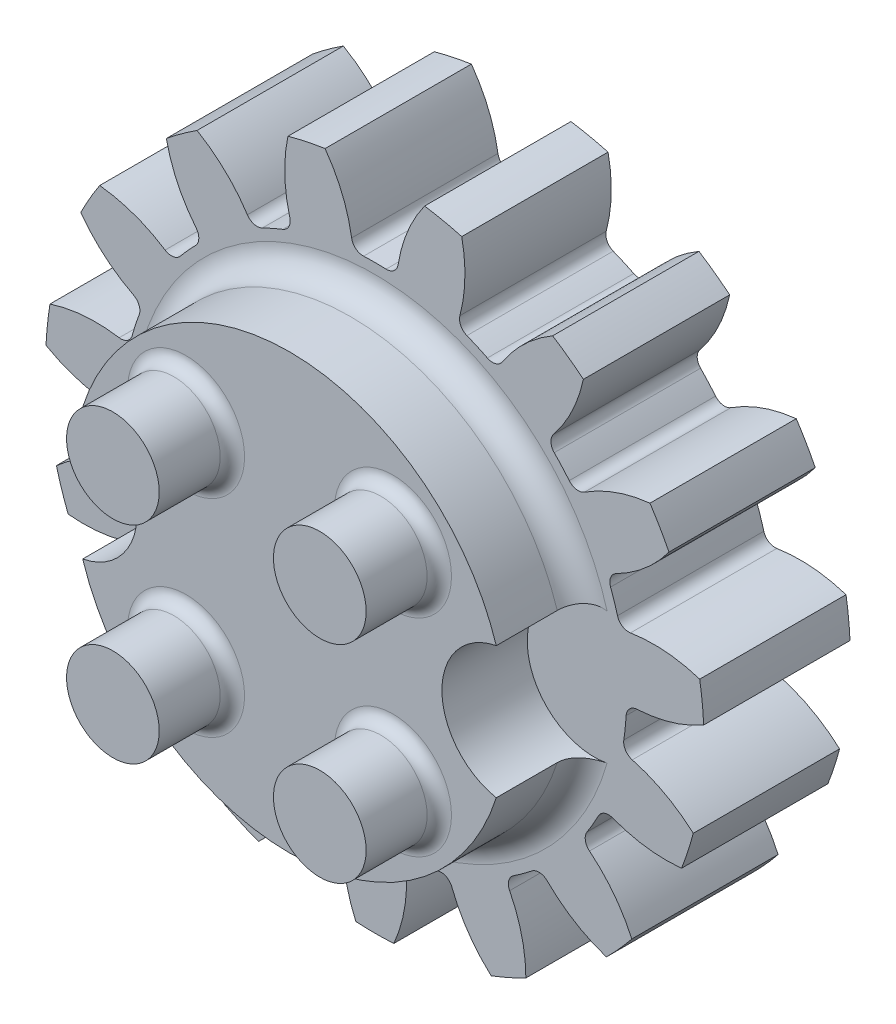
from build123d import *

# Parameters (mm, degrees)
SKETCH1_R                      = 13.5
BOSS_EXTRUDE1_DEPTH            = 3
CUT_EXTRUDE1_DEPTH             = 20.32614809
FILLET2_R                      = 0.476470588
CIRPATTERN1_COUNT              = 15
FILLET2_OF_CIRPATTERN1_R       = 0.476470588
THROUGH_CENTER_HOLE_DEPTH      = 20.315736881
THROUGH_CENTER_HOLE_DEPTH_BACK = 20.315736881
SKETCH5_R                      = 1.25
BOSS_EXTRUDE2_DEPTH            = 3.5
SKETCH7_R                      = 1.9
BOSS_EXTRUDE3_DEPTH            = 3
FILLET3_R                      = 1
FILLET4_R                      = 0.5


with BuildPart() as part:
    # Sketch1 → Boss-Extrude1 (new, symmetric)
    with BuildSketch(Plane.XY):
        Circle(SKETCH1_R)
    extrude(amount=BOSS_EXTRUDE1_DEPTH, both=True)

    # Sketch3 → Cut-Extrude1 (cut, symmetric)
    with BuildSketch(Plane.XY):
        with BuildLine():
            ThreePointArc((-2.040384037, 13.344917871), (-1.26191316, 11.892090906), (-0.898861073, 10.284323424))
            ThreePointArc((-0.898861073, 10.284323424), (0, 10.323529412), (0.898861073, 10.284323424))
            ThreePointArc((0.898861073, 10.284323424), (1.26191316, 11.892090906), (2.040384037, 13.344917871))
            ThreePointArc((2.040384037, 13.344917871), (0, 13.5), (-2.040384037, 13.344917871))
        make_face()
    cut_extrude1 = extrude(amount=CUT_EXTRUDE1_DEPTH, both=True, mode=Mode.SUBTRACT)

    # Fillet2
    fillet2_edges = [part.edges().sort_by_distance(p)[0] for p in [
        (0.898861073, 10.284323424, 0),
        (-0.898861073, 10.284323424, 0),
    ]]
    fillet(fillet2_edges, radius=FILLET2_R)

    # CirPattern1: Cut-Extrude1 ×15 about axis
    cirpattern1_axis = Axis((0, 0, 0), (0, 0, 1))
    for i in range(1, CIRPATTERN1_COUNT):
        add(cut_extrude1.rotate(cirpattern1_axis, i * 360 / CIRPATTERN1_COUNT), mode=Mode.SUBTRACT)

    # Fillet2 of CirPattern1
    fillet2_of_cirpattern1_edges = [part.edges().sort_by_distance(p)[0] for p in [
        (-3.361860735, 9.760796684, 0),
        (-5.004161636, 9.029597213, 0),
        (-7.041286281, 7.549539524, 0),
        (-8.244197191, 6.213571613, 0),
        (-9.503209461, 4.032898395, 0),
        (-10.058736155, 2.323163032, 0),
        (-10.321941391, -0.181067505, 0),
        (-10.134028257, -1.968941542, 0),
        (-9.355915883, -4.363725188, 0),
        (-8.457054809, -5.920598236, 0),
        (-6.772167522, -7.791855143, 0),
        (-5.317779754, -8.848529708, 0),
        (-3.017449874, -9.872702557, 0),
        (-1.25901227, -10.246470008, 0),
        (1.25901227, -10.246470008, 0),
        (3.017449874, -9.872702557, 0),
        (5.317779754, -8.848529708, 0),
        (6.772167522, -7.791855143, 0),
        (8.457054809, -5.920598236, 0),
        (9.355915883, -4.363725188, 0),
        (10.134028257, -1.968941542, 0),
        (10.321941391, -0.181067505, 0),
        (10.058736155, 2.323163032, 0),
        (9.503209461, 4.032898395, 0),
        (8.244197191, 6.213571613, 0),
        (7.041286281, 7.549539524, 0),
        (5.004161636, 9.029597213, 0),
        (3.361860735, 9.760796684, 0),
    ]]
    fillet(fillet2_of_cirpattern1_edges, radius=FILLET2_OF_CIRPATTERN1_R)

    # Sketch5 → Through_Center_Hole (cut, two sides: drawn at the far end of the back side and taken through both)
    with BuildSketch(Plane.XY.offset(-THROUGH_CENTER_HOLE_DEPTH_BACK)):
        Circle(SKETCH5_R)
    extrude(amount=THROUGH_CENTER_HOLE_DEPTH + THROUGH_CENTER_HOLE_DEPTH_BACK, mode=Mode.SUBTRACT)

    # Sketch6 → Boss-Extrude2 (add)
    with BuildSketch(Plane.XY.offset(3)):
        with BuildLine():
            ThreePointArc((-8.480416667, -2.700469063), (-6.25, 0), (-8.480416667, 2.700469063))
            ThreePointArc((-8.480416667, 2.700469063), (0, 8.9), (8.480416667, 2.700469063))
            ThreePointArc((8.480416667, 2.700469063), (6.25, 0), (8.480416667, -2.700469063))
            ThreePointArc((8.480416667, -2.700469063), (0, -8.9), (-8.480416667, -2.700469063))
        make_face()
    extrude(amount=BOSS_EXTRUDE2_DEPTH)

    # Sketch7 → Boss-Extrude3 (add)
    with BuildSketch(Plane.XY.offset(6.5)):
        with Locations((-4.242640687, 4.242640687)):
            Circle(SKETCH7_R)
        with Locations((4.242640687, 4.242640687)):
            Circle(SKETCH7_R)
        with Locations((4.242640687, -4.242640687)):
            Circle(SKETCH7_R)
        with Locations((-4.242640687, -4.242640687)):
            Circle(SKETCH7_R)
    extrude(amount=BOSS_EXTRUDE3_DEPTH)

    # Fillet3
    # the kernel refuses this fillet: 1 mm, written as the material it adds along each edge
    with BuildSketch(Plane(origin=(0, 0, 3), x_dir=(0.9996330098529925, -0.02708958494047193, 0), z_dir=(0.02708958494047193, 0.9996330098529925, 0))) as fillet3_piece_1_section:
        with BuildLine():
            CenterArc((8.9 + FILLET3_R, -FILLET3_R), FILLET3_R, 90, 90)
            Line((8.9, -FILLET3_R), (8.9, 0))
            Line((8.9, 0), (8.9 + FILLET3_R, 0))
        make_face()
    fillet3_piece_1 = revolve(axis=Axis((0, 0, 3), (0, 0, -1)), revolution_arc=176.895382431, mode=Mode.PRIVATE)
    fillet3_piece_1 = fillet3_piece_1 - Plane(origin=(9, 0, 3.280116287), x_dir=(-0.18893939393939513, 0.9819887501482969, 0), z_dir=(0, 0, -1)) * Cylinder(2.75, 40, mode=Mode.PRIVATE)
    fillet3_piece_1 = fillet3_piece_1 - Plane(origin=(-9, 0, 3.280116287), x_dir=(0.18893939393939513, -0.9819887501482969, 0), z_dir=(0, 0, -1)) * Cylinder(2.75, 40, mode=Mode.PRIVATE)
    add(fillet3_piece_1)
    with BuildSketch(Plane(origin=(0, 0, 3), x_dir=(-0.9996330098529925, 0.027089584940471288, 0), z_dir=(-0.027089584940471288, -0.9996330098529925, 0))) as fillet3_piece_2_section:
        with BuildLine():
            CenterArc((8.9 + FILLET3_R, -FILLET3_R), FILLET3_R, 90, 90)
            Line((8.9, -FILLET3_R), (8.9, 0))
            Line((8.9, 0), (8.9 + FILLET3_R, 0))
        make_face()
    fillet3_piece_2 = revolve(axis=Axis((0, 0, 3), (0, 0, -1)), revolution_arc=176.895382431, mode=Mode.PRIVATE)
    fillet3_piece_2 = fillet3_piece_2 - Plane(origin=(9, 0, 3.280116287), x_dir=(-0.18893939393939513, 0.9819887501482969, 0), z_dir=(0, 0, -1)) * Cylinder(2.75, 40, mode=Mode.PRIVATE)
    fillet3_piece_2 = fillet3_piece_2 - Plane(origin=(-9, 0, 3.280116287), x_dir=(0.18893939393939513, -0.9819887501482969, 0), z_dir=(0, 0, -1)) * Cylinder(2.75, 40, mode=Mode.PRIVATE)
    add(fillet3_piece_2)

    # Fillet4
    fillet4_edges = [part.edges().sort_by_distance(p)[0] for p in [
        (-6.142640687, 4.242640687, 6.5),
        (2.342640687, 4.242640687, 6.5),
        (2.342640687, -4.242640687, 6.5),
        (-6.142640687, -4.242640687, 6.5),
    ]]
    fillet(fillet4_edges, radius=FILLET4_R)


solid = part.part
